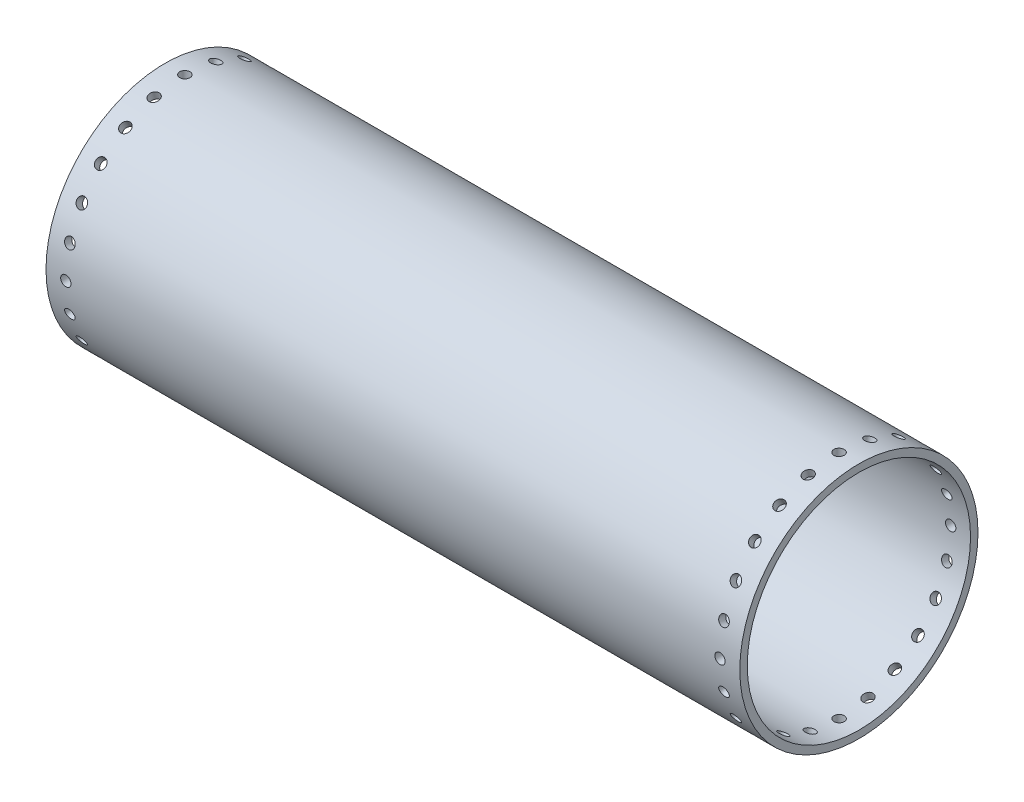
from build123d import *

# Parameters (mm, degrees)
TUBE_SKETCH_W                = 443.904817902
TUBE_SKETCH_H                = 4.775
TOP_SCREW_HOLE_SKETCH_W      = 3.3
TOP_SCREW_HOLE_SKETCH_H      = 6.775
TOP_SCREW_HOLES_X24_COUNT    = 24
BOTTOM_SCREW_HOLE_SKETCH_W   = 3.3
BOTTOM_SCREW_HOLE_SKETCH_H   = 6.775
BOTTOM_SCREW_HOLES_X24_COUNT = 24


with BuildPart() as part:
    # Tube Sketch → Tube (revolve)
    with BuildSketch(Plane.XY):
        with Locations((221.952408951, 73.8125)):
            Rectangle(TUBE_SKETCH_W, TUBE_SKETCH_H)
    revolve(axis=Axis((-1000, 0, 0), (1, 0, 0)))

    # Top Screw Hole Sketch → Top Screw Hole (revolve, cut)
    with BuildSketch(Plane.XY):
        with Locations((14.35, 73.8125)):
            Rectangle(TOP_SCREW_HOLE_SKETCH_W, TOP_SCREW_HOLE_SKETCH_H)
    top_screw_hole = revolve(axis=Axis((12.7, 51.425, 0), (0, 1, 0)), mode=Mode.SUBTRACT)

    # Top Screw Holes x24: Top Screw Hole ×24 about axis
    top_screw_holes_x24_axis = Axis((466.100058797, 0, 0), (-1, 0, 0))
    for i in range(1, TOP_SCREW_HOLES_X24_COUNT):
        add(top_screw_hole.rotate(top_screw_holes_x24_axis, i * 360 / TOP_SCREW_HOLES_X24_COUNT), mode=Mode.SUBTRACT)

    # Bottom Screw Hole Sketch → Bottom Screw Hole (revolve, cut)
    with BuildSketch(Plane.XY):
        with Locations((432.854817902, 73.8125)):
            Rectangle(BOTTOM_SCREW_HOLE_SKETCH_W, BOTTOM_SCREW_HOLE_SKETCH_H)
    bottom_screw_hole = revolve(axis=Axis((431.204817902, 51.425, 0), (0, 1, 0)), mode=Mode.SUBTRACT)

    # Bottom Screw Holes x24: Bottom Screw Hole ×24 about axis
    bottom_screw_holes_x24_axis = Axis((466.100058797, 0, 0), (-1, 0, 0))
    for i in range(1, BOTTOM_SCREW_HOLES_X24_COUNT):
        add(bottom_screw_hole.rotate(bottom_screw_holes_x24_axis, i * 360 / BOTTOM_SCREW_HOLES_X24_COUNT), mode=Mode.SUBTRACT)


solid = part.part
